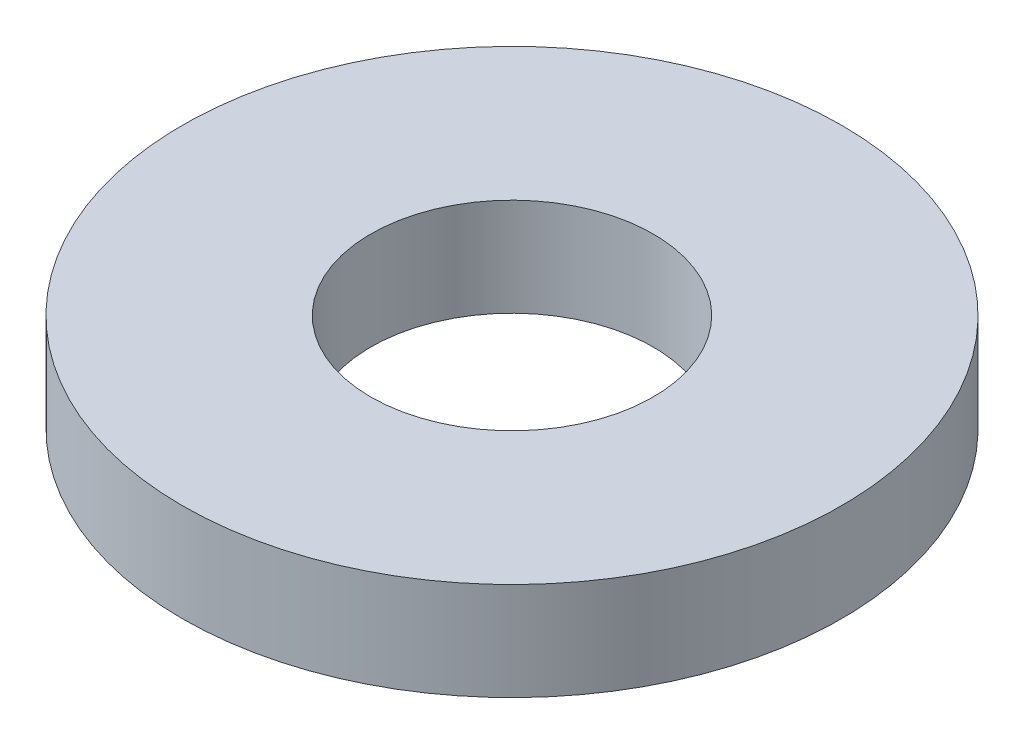
from build123d import *

# Parameters (mm, degrees)
SKETCH1_R           = 5.55625
BOSS_EXTRUDE1_DEPTH = 1.651
SKETCH5_R           = 2.38125
CUT_EXTRUDE1_DEPTH  = 9.029298171


with BuildPart() as part:
    # Sketch1 → Boss-Extrude1 (new body)
    with BuildSketch(Plane(origin=(0, 0, 0), x_dir=(1, 0, 0), z_dir=(0, 1, 0))):
        Circle(SKETCH1_R)
    extrude(amount=BOSS_EXTRUDE1_DEPTH)

    # Sketch5 → Cut-Extrude1 (cut, through all)
    with BuildSketch(Plane(origin=(0, 1.651, 0), x_dir=(-1, 0, 0), z_dir=(0, 1, 0))):
        Circle(SKETCH5_R)
    extrude(amount=-CUT_EXTRUDE1_DEPTH, mode=Mode.SUBTRACT)


solid = part.part
